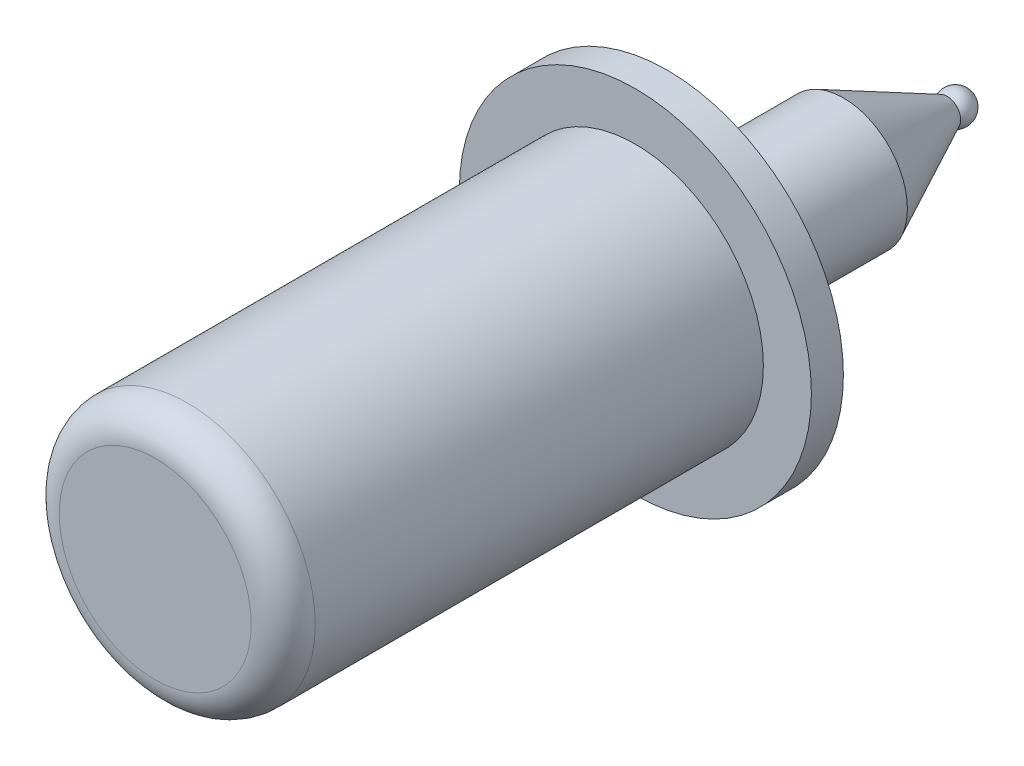
from build123d import *


with BuildPart() as part:
    # Sketch5 → Revolve1 (revolve)
    with BuildSketch(Plane(origin=(0, 0, 0), x_dir=(0, 0, -1), z_dir=(1, 0, 0))):
        with BuildLine():
            Line((0, 0), (0, 3))
            ThreePointArc((0, 3), (0.292893219, 3.707106781), (1, 4))
            Line((1, 4), (15, 4))
            Line((15, 4), (15, 5.5))
            Line((15, 5.5), (16, 5.5))
            Line((16, 5.5), (16, 2))
            Line((16, 2), (21.5, 2))
            Line((21.5, 2), (24.738971507, 0.426455304))
            ThreePointArc((24.738971507, 0.426455304), (25.24442356, 0.436184735), (25.5, 0))
            Line((25.5, 0), (0, 0))
        make_face()
    revolve(axis=Axis((0, 0, 0), (0, 0, -1)))


solid = part.part
